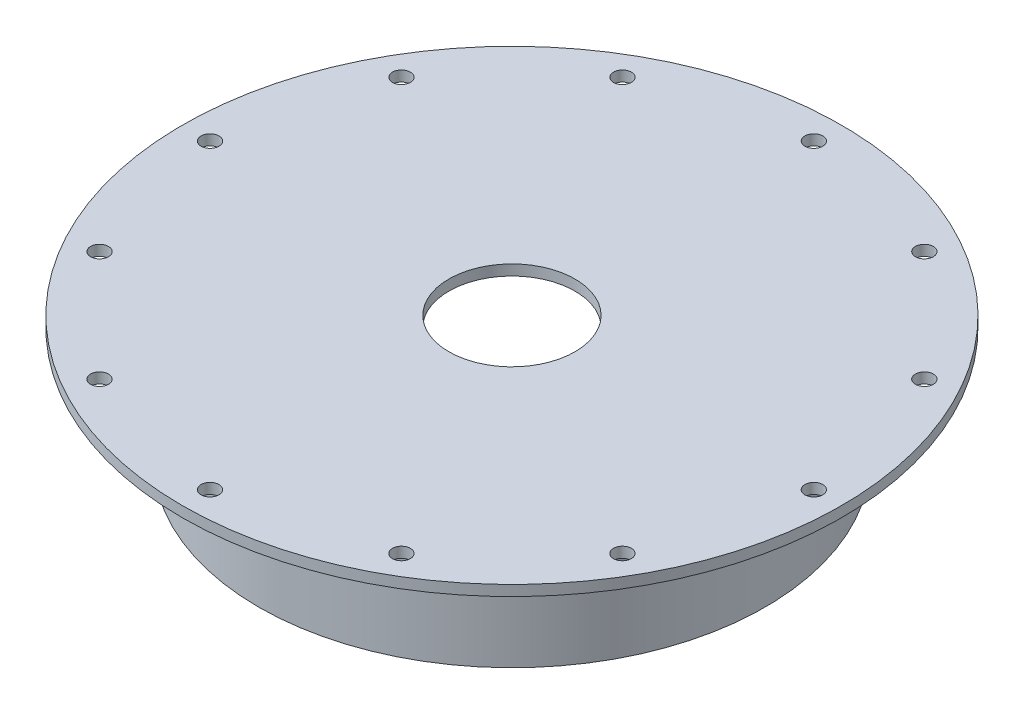
from build123d import *

# Parameters (mm, degrees)
F_36_0_1065_DIAMETER_HOLE1_D = 2.7051
CIRPATTERN1_COUNT            = 12


with BuildPart() as part:
    # Sketch1 → Revolve1 (revolve)
    with BuildSketch(Plane.XY):
        with BuildLine():
            Line((-49.784, 0), (-41.427399999, 0))
            ThreePointArc((-41.427399999, 0), (-39.182335969, -0.92993597), (-38.252399999, -3.175))
            Line((-38.252399999, -3.175), (-38.2524, -17.4625))
            Line((-38.2524, -17.4625), (-35.0774, -17.4625))
            Line((-35.0774, -17.4625), (-35.0774, -3.175))
            ThreePointArc((-35.0774, -3.175), (-34.14746403, -0.92993597), (-31.9024, 0))
            Line((-31.9024, 0), (-9.525, 0))
            Line((-9.525, 0), (-9.525, 1.5875))
            Line((-9.525, 1.5875), (-49.784, 1.5875))
            Line((-49.784, 1.5875), (-49.784, 0))
        make_face()
    revolve(axis=Axis((0, 55, 0), (0, -1, 0)))

    # #36 (0.1065) Diameter Hole1 (through all)
    with Locations(Plane(origin=(0, 1.5875, 0), x_dir=(1, 0, 0), z_dir=(0, 1, 0))):
        with Locations((-45.6057, 0)):
            f_36_0_1065_diameter_hole1 = Hole(F_36_0_1065_DIAMETER_HOLE1_D / 2)

    # CirPattern1: #36 (0.1065) Diameter Hole1 ×12 about axis
    cirpattern1_axis = Axis((0, 55, 0), (0, -1, 0))
    for i in range(1, CIRPATTERN1_COUNT):
        add(f_36_0_1065_diameter_hole1.rotate(cirpattern1_axis, i * 360 / CIRPATTERN1_COUNT), mode=Mode.SUBTRACT)


solid = part.part
